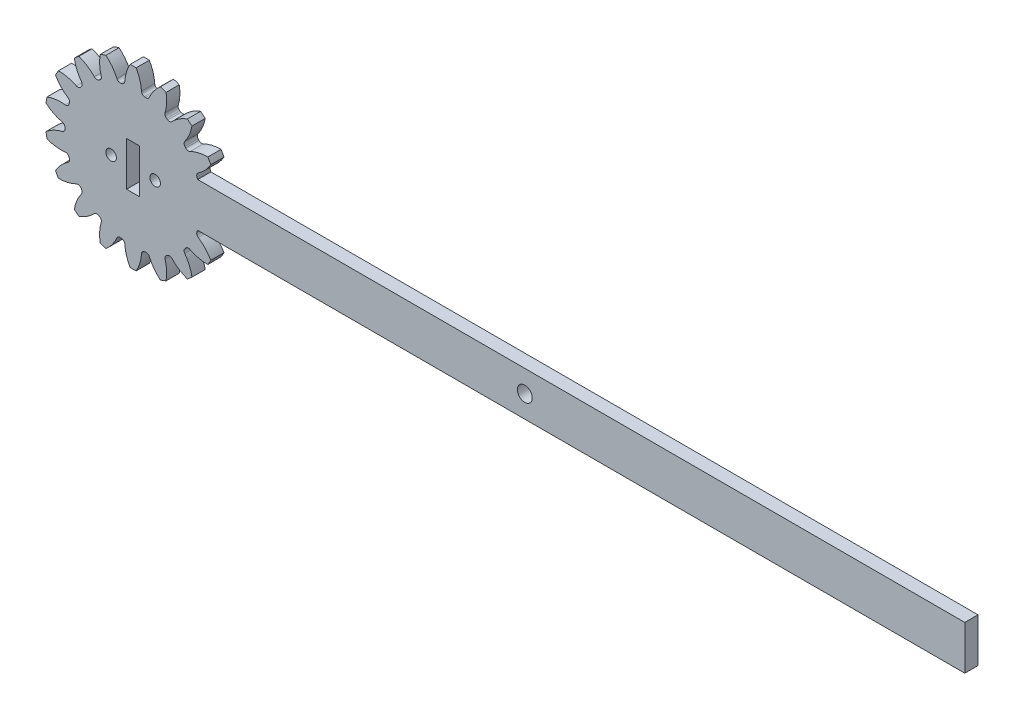
from build123d import *

# Parameters (mm, degrees)
AUFSATZ_LINEAR_AUSTRAGEN1_DEPTH = 1.5
DURCHGANGSLOCH_F_R_M31_D        = 3.4
AUFSATZ_LINEAR_AUSTRAGEN2_DEPTH = 3
SKIZZE5_W                       = 4
SKIZZE5_H                       = 4
SCHNITT_LINEAR_AUSTRAGEN1_DEPTH = 145.617599206
F_36MM_SPUR_GEAR1_START         = -20
F_36MM_SPUR_GEAR1_DEPTH         = 3
SKIZZE7_W                       = 3
SKIZZE7_H                       = 10
SCHNITT_LINEAR_AUSTRAGEN3_DEPTH = 146.908361659
SKIZZE8_R                       = 1.2
SCHNITT_LINEAR_AUSTRAGEN4_DEPTH = 146.908361659


with BuildPart() as part:
    # Skizze1 → Aufsatz-Linear austragen1 (new, symmetric)
    with BuildSketch(Plane.XY):
        with BuildLine():
            Line((-44.5, 5), (44.5, 5))
            ThreePointArc((44.5, 5), (49.5, 0), (44.5, -5))
            Line((44.5, -5), (-44.5, -5))
            ThreePointArc((-44.5, -5), (-49.5, 0), (-44.5, 5))
        make_face()
    extrude(amount=AUFSATZ_LINEAR_AUSTRAGEN1_DEPTH, both=True)

    # Durchgangsloch für M31 (through all)
    with Locations(Plane.XY.offset(1.5)):
        with Locations((-44.5, 0), (44.5, 0)):
            Hole(DURCHGANGSLOCH_F_R_M31_D / 2)

    # Skizze4 → Aufsatz-Linear austragen2 (add)
    with BuildSketch(Plane.XY.offset(1.5)):
        with BuildLine():
            Line((44.5, 5), (144.5, 5))
            Line((144.5, 5), (144.5, -5))
            Line((144.5, -5), (44.5, -5))
            ThreePointArc((44.5, -5), (49.5, 0), (44.5, 5))
        make_face()
    extrude(amount=-AUFSATZ_LINEAR_AUSTRAGEN2_DEPTH)

    # Skizze5 → Schnitt-Linear austragen1 (cut, through all)
    with BuildSketch(Plane.XY.offset(1.5)):
        with Locations((-44.5, 0)):
            Rectangle(SKIZZE5_W, SKIZZE5_H)
    extrude(amount=-SCHNITT_LINEAR_AUSTRAGEN1_DEPTH, mode=Mode.SUBTRACT)


with BuildPart() as body_2:
    # 36mm_spur_gear1: read off the stored shape, not the designer's step
    # 36mm_spur_gear1 outline → 36mm_spur_gear1 (new body)
    with BuildSketch(Plane.XY.offset(F_36MM_SPUR_GEAR1_START)):
        with BuildLine():
            ThreePointArc((-68.651249783, 18.637616045), (-69.025162545, 20.70563552), (-69.867010124, 22.631202439))
            ThreePointArc((-69.867010124, 22.631202439), (-70.548541939, 22.642817953), (-71.230073753, 22.631202439))
            ThreePointArc((-71.230073753, 22.631202439), (-72.071921332, 20.70563552), (-72.445834093, 18.637616045))
            ThreePointArc((-72.445834093, 18.637616045), (-72.644060056, 18.163145097), (-73.09332879, 17.912997508))
            Line((-73.09332879, 17.912997508), (-73.379933512, 17.862461362))
            ThreePointArc((-73.379933512, 17.862461362), (-73.887663541, 17.94386425), (-74.236213637, 18.321923825))
            ThreePointArc((-74.236213637, 18.321923825), (-75.294881017, 20.13734077), (-76.744541648, 21.658852965))
            ThreePointArc((-76.744541648, 21.658852965), (-77.388944805, 21.436670368), (-78.025402482, 21.192657747))
            ThreePointArc((-78.025402482, 21.192657747), (-78.157897766, 19.095287893), (-77.801956511, 17.024099556))
            ThreePointArc((-77.801956511, 17.024099556), (-77.825949365, 16.510445436), (-78.162568364, 16.121724635))
            Line((-78.162568364, 16.121724635), (-78.414604327, 15.976211604))
            ThreePointArc((-78.414604327, 15.976211604), (-78.919555916, 15.879051399), (-79.376389859, 16.115100039))
            ThreePointArc((-79.376389859, 16.115100039), (-80.992120948, 17.458948377), (-82.874744165, 18.392889021))
            ThreePointArc((-82.874744165, 18.392889021), (-83.404294132, 17.963706815), (-83.918911483, 17.51672861))
            ThreePointArc((-83.918911483, 17.51672861), (-83.326073586, 15.500529579), (-82.283210083, 13.675988261))
            ThreePointArc((-82.283210083, 13.675988261), (-82.130075935, 13.185105236), (-82.313443981, 12.704696689))
            Line((-82.313443981, 12.704696689), (-82.500511927, 12.481757791))
            ThreePointArc((-82.500511927, 12.481757791), (-82.941780462, 12.217753449), (-83.451797337, 12.283320203))
            ThreePointArc((-83.451797337, 12.283320203), (-85.429711119, 12.993511991), (-87.518224777, 13.227234061))
            ThreePointArc((-87.518224777, 13.227234061), (-87.869050014, 12.642817953), (-88.199756591, 12.046786331))
            ThreePointArc((-88.199756591, 12.046786331), (-86.953090513, 10.354941482), (-85.349089492, 8.997113794))
            ThreePointArc((-85.349089492, 8.997113794), (-85.037298579, 8.588209601), (-85.045298779, 8.074057669))
            Line((-85.045298779, 8.074057669), (-85.144835555, 7.800582626))
            ThreePointArc((-85.144835555, 7.800582626), (-85.469197538, 7.401576967), (-85.970881782, 7.288753517))
            ThreePointArc((-85.970881782, 7.288753517), (-88.072412665, 7.279629144), (-90.114911193, 6.784942308))
            ThreePointArc((-90.114911193, 6.784942308), (-90.244696998, 6.115781506), (-90.351604708, 5.442586678))
            ThreePointArc((-90.351604708, 5.442586678), (-88.601476776, 4.279157469), (-86.629804432, 3.55181747))
            ThreePointArc((-86.629804432, 3.55181747), (-86.196963342, 3.274211989), (-86.028630753, 2.788330984))
            Line((-86.028630753, 2.788330984), (-86.028630753, 2.497304922))
            ThreePointArc((-86.028630753, 2.497304922), (-86.196963342, 2.011423916), (-86.629804432, 1.733818435))
            ThreePointArc((-86.629804432, 1.733818435), (-88.601476776, 1.006478436), (-90.351604708, -0.156950773))
            ThreePointArc((-90.351604708, -0.156950773), (-90.244696998, -0.830145601), (-90.114911193, -1.499306403))
            ThreePointArc((-90.114911193, -1.499306403), (-88.072412665, -1.993993239), (-85.970881782, -2.003117612))
            ThreePointArc((-85.970881782, -2.003117612), (-85.469197538, -2.115941062), (-85.144835555, -2.514946721))
            Line((-85.144835555, -2.514946721), (-85.045298779, -2.788421764))
            ThreePointArc((-85.045298779, -2.788421764), (-85.037298579, -3.302573696), (-85.349089492, -3.711477889))
            ThreePointArc((-85.349089492, -3.711477889), (-86.953090513, -5.069305577), (-88.199756591, -6.761150426))
            ThreePointArc((-88.199756591, -6.761150426), (-87.869050014, -7.357182048), (-87.518224777, -7.941598156))
            ThreePointArc((-87.518224777, -7.941598156), (-85.429711119, -7.707876086), (-83.451797337, -6.997684298))
            ThreePointArc((-83.451797337, -6.997684298), (-82.941780462, -6.932117544), (-82.500511927, -7.196121886))
            Line((-82.500511927, -7.196121886), (-82.313443981, -7.419060783))
            ThreePointArc((-82.313443981, -7.419060783), (-82.130075935, -7.89946933), (-82.283210083, -8.390352356))
            ThreePointArc((-82.283210083, -8.390352356), (-83.326073586, -10.214893673), (-83.918911483, -12.231092704))
            ThreePointArc((-83.918911483, -12.231092704), (-83.404294132, -12.67807091), (-82.874744165, -13.107253116))
            ThreePointArc((-82.874744165, -13.107253116), (-80.992120948, -12.173312471), (-79.376389859, -10.829464134))
            ThreePointArc((-79.376389859, -10.829464134), (-78.919555916, -10.593415494), (-78.414604327, -10.690575699))
            Line((-78.414604327, -10.690575699), (-78.162568364, -10.83608873))
            ThreePointArc((-78.162568364, -10.83608873), (-77.825949365, -11.224809531), (-77.801956511, -11.738463651))
            ThreePointArc((-77.801956511, -11.738463651), (-78.157897766, -13.809651988), (-78.025402482, -15.907021842))
            ThreePointArc((-78.025402482, -15.907021842), (-77.388944805, -16.151034463), (-76.744541648, -16.37321706))
            ThreePointArc((-76.744541648, -16.37321706), (-75.294881017, -14.851704865), (-74.236213637, -13.03628792))
            ThreePointArc((-74.236213637, -13.03628792), (-73.887663541, -12.658228345), (-73.379933512, -12.576825457))
            Line((-73.379933512, -12.576825457), (-73.09332879, -12.627361603))
            ThreePointArc((-73.09332879, -12.627361603), (-72.644060056, -12.877509192), (-72.445834093, -13.35198014))
            ThreePointArc((-72.445834093, -13.35198014), (-72.071921332, -15.419999615), (-71.230073753, -17.345566534))
            ThreePointArc((-71.230073753, -17.345566534), (-70.548541939, -17.357182047), (-69.867010124, -17.345566534))
            ThreePointArc((-69.867010124, -17.345566534), (-69.025162545, -15.419999615), (-68.651249783, -13.35198014))
            ThreePointArc((-68.651249783, -13.35198014), (-68.453023821, -12.877509192), (-68.003755086, -12.627361603))
            Line((-68.003755086, -12.627361603), (-67.717150364, -12.576825457))
            ThreePointArc((-67.717150364, -12.576825457), (-67.209420336, -12.658228345), (-66.86087024, -13.03628792))
            ThreePointArc((-66.86087024, -13.03628792), (-65.802202859, -14.851704865), (-64.352542228, -16.37321706))
            ThreePointArc((-64.352542228, -16.37321706), (-63.708139072, -16.151034463), (-63.071681394, -15.907021842))
            ThreePointArc((-63.071681394, -15.907021842), (-62.93918611, -13.809651988), (-63.295127365, -11.738463651))
            ThreePointArc((-63.295127365, -11.738463651), (-63.271134512, -11.224809531), (-62.934515512, -10.83608873))
            Line((-62.934515512, -10.83608873), (-62.682479549, -10.690575699))
            ThreePointArc((-62.682479549, -10.690575699), (-62.17752796, -10.593415494), (-61.720694017, -10.829464134))
            ThreePointArc((-61.720694017, -10.829464134), (-60.104962929, -12.173312471), (-58.222339712, -13.107253116))
            ThreePointArc((-58.222339712, -13.107253116), (-57.692789744, -12.67807091), (-57.178172393, -12.231092704))
            ThreePointArc((-57.178172393, -12.231092704), (-57.77101029, -10.214893673), (-58.813873793, -8.390352356))
            ThreePointArc((-58.813873793, -8.390352356), (-58.967007942, -7.89946933), (-58.783639896, -7.419060783))
            Line((-58.783639896, -7.419060783), (-58.596571949, -7.196121886))
            ThreePointArc((-58.596571949, -7.196121886), (-58.155303414, -6.932117544), (-57.645286539, -6.997684298))
            ThreePointArc((-57.645286539, -6.997684298), (-55.667372757, -7.707876086), (-53.578859099, -7.941598156))
            ThreePointArc((-53.578859099, -7.941598156), (-53.228033862, -7.357182048), (-52.897327285, -6.761150426))
            ThreePointArc((-52.897327285, -6.761150426), (-54.143993364, -5.069305577), (-55.747994385, -3.711477889))
            ThreePointArc((-55.747994385, -3.711477889), (-56.059785297, -3.302573696), (-56.051785097, -2.788421764))
            Line((-56.051785097, -2.788421764), (-55.952248322, -2.514946721))
            ThreePointArc((-55.952248322, -2.514946721), (-55.627886339, -2.115941062), (-55.126202094, -2.003117612))
            ThreePointArc((-55.126202094, -2.003117612), (-53.024671211, -1.993993239), (-50.982172683, -1.499306403))
            ThreePointArc((-50.982172683, -1.499306403), (-50.852386878, -0.830145601), (-50.745479168, -0.156950773))
            ThreePointArc((-50.745479168, -0.156950773), (-52.4956071, 1.006478436), (-54.467279444, 1.733818435))
            ThreePointArc((-54.467279444, 1.733818435), (-54.900120534, 2.011423916), (-55.068453123, 2.497304922))
            Line((-55.068453123, 2.497304922), (-55.068453123, 2.788330984))
            ThreePointArc((-55.068453123, 2.788330984), (-54.900120534, 3.274211989), (-54.467279444, 3.55181747))
            ThreePointArc((-54.467279444, 3.55181747), (-52.4956071, 4.279157469), (-50.745479168, 5.442586678))
            ThreePointArc((-50.745479168, 5.442586678), (-50.852386878, 6.115781506), (-50.982172683, 6.784942308))
            ThreePointArc((-50.982172683, 6.784942308), (-53.024671211, 7.279629144), (-55.126202094, 7.288753517))
            ThreePointArc((-55.126202094, 7.288753517), (-55.627886339, 7.401576967), (-55.952248322, 7.800582626))
            Line((-55.952248322, 7.800582626), (-56.051785097, 8.074057669))
            ThreePointArc((-56.051785097, 8.074057669), (-56.059785297, 8.588209601), (-55.747994385, 8.997113794))
            ThreePointArc((-55.747994385, 8.997113794), (-54.143993364, 10.354941482), (-52.897327285, 12.046786331))
            ThreePointArc((-52.897327285, 12.046786331), (-53.228033862, 12.642817953), (-53.578859099, 13.227234061))
            ThreePointArc((-53.578859099, 13.227234061), (-55.667372757, 12.993511991), (-57.645286539, 12.283320203))
            ThreePointArc((-57.645286539, 12.283320203), (-58.155303414, 12.217753449), (-58.596571949, 12.481757791))
            Line((-58.596571949, 12.481757791), (-58.783639896, 12.704696689))
            ThreePointArc((-58.783639896, 12.704696689), (-58.967007942, 13.185105236), (-58.813873793, 13.675988261))
            ThreePointArc((-58.813873793, 13.675988261), (-57.77101029, 15.500529579), (-57.178172393, 17.51672861))
            ThreePointArc((-57.178172393, 17.51672861), (-57.692789744, 17.963706815), (-58.222339712, 18.392889021))
            ThreePointArc((-58.222339712, 18.392889021), (-60.104962929, 17.458948377), (-61.720694017, 16.115100039))
            ThreePointArc((-61.720694017, 16.115100039), (-62.17752796, 15.879051399), (-62.682479549, 15.976211604))
            Line((-62.682479549, 15.976211604), (-62.934515512, 16.121724635))
            ThreePointArc((-62.934515512, 16.121724635), (-63.271134512, 16.510445436), (-63.295127365, 17.024099556))
            ThreePointArc((-63.295127365, 17.024099556), (-62.93918611, 19.095287893), (-63.071681394, 21.192657747))
            ThreePointArc((-63.071681394, 21.192657747), (-63.708139072, 21.436670368), (-64.352542228, 21.658852965))
            ThreePointArc((-64.352542228, 21.658852965), (-65.802202859, 20.13734077), (-66.86087024, 18.321923825))
            ThreePointArc((-66.86087024, 18.321923825), (-67.209420336, 17.94386425), (-67.717150364, 17.862461362))
            Line((-67.717150364, 17.862461362), (-68.003755086, 17.912997508))
            ThreePointArc((-68.003755086, 17.912997508), (-68.453023821, 18.163145097), (-68.651249783, 18.637616045))
        make_face()
        with BuildLine():
            Line((-70.548541938, 3.642817953), (-70.548541938, 1.642817953))
            ThreePointArc((-70.548541938, 1.642817953), (-71.548541938, 2.642817953), (-70.548541938, 3.642817953))
        make_face(mode=Mode.SUBTRACT)
    extrude(amount=F_36MM_SPUR_GEAR1_DEPTH)


with BuildPart() as body_2_1:
    # Körper-Verschieben/Kopieren6: read off the stored shape, not the designer's step
    # Körper-Verschieben/Kopieren6: moved
    add(body_2.part.moved(Location((26.0485419, -2.642818, 18.5))))

    # Kombinieren2: union part
    add(part.part)

    # Skizze7 → Schnitt-Linear austragen3 (cut, through all)
    with BuildSketch(Plane.XY.offset(1.5)):
        with Locations((-44.5, 0)):
            Rectangle(SKIZZE7_W, SKIZZE7_H)
    extrude(amount=-SCHNITT_LINEAR_AUSTRAGEN3_DEPTH, mode=Mode.SUBTRACT)

    # Skizze8 → Schnitt-Linear austragen4 (cut, through all)
    with BuildSketch(Plane.XY.offset(1.5)):
        with Locations((-49.5, 0)):
            Circle(SKIZZE8_R)
        with Locations((-39.5, 0)):
            Circle(SKIZZE8_R)
    extrude(amount=-SCHNITT_LINEAR_AUSTRAGEN4_DEPTH, mode=Mode.SUBTRACT)


solid = body_2_1.part
